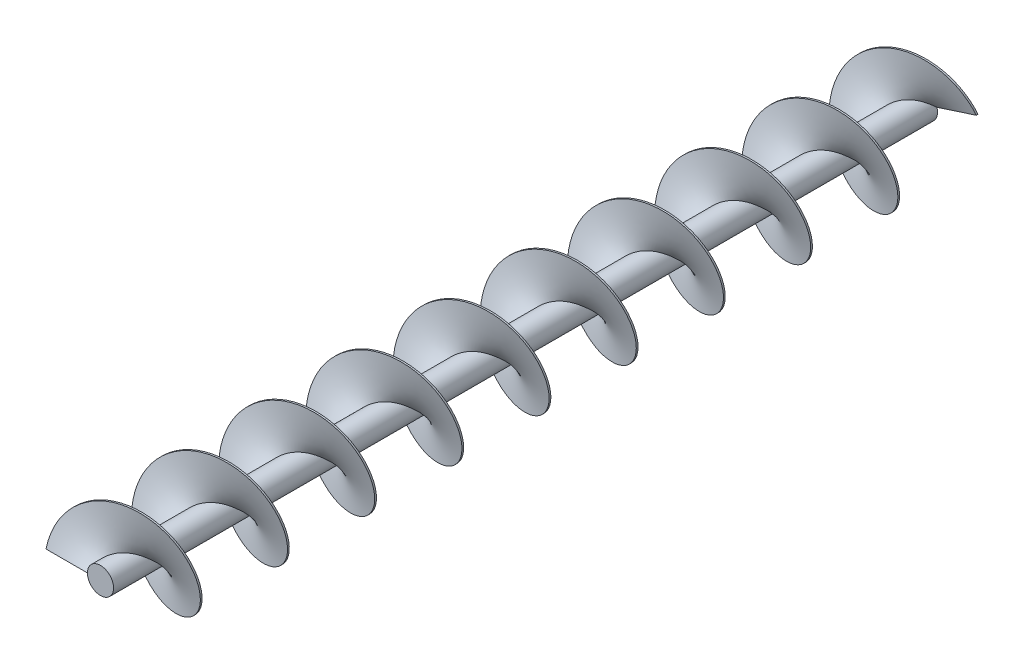
from build123d import *

# Parameters (mm, degrees)
SKETCH1_R           = 1.905
BOSS_EXTRUDE1_DEPTH = 60.0075
SWEEP1_PITCH        = 12.7
SKETCH6_R           = 1.27
SKETCH6_W           = 0.762
SKETCH6_H           = 1.524
CUT_EXTRUDE1_DEPTH  = 12.7


with BuildPart() as part:
    # Sketch1 → Boss-Extrude1 (new, symmetric)
    with BuildSketch(Plane.XY):
        with Locations(Location((0, 0, 0), (0, 0, 180))):
            Circle(SKETCH1_R)
    extrude(amount=BOSS_EXTRUDE1_DEPTH, both=True)

    # Sweep1: the profile of Sketch5 profile screwed along a right-hand helix of 9.45 turns, 18 arcs to a turn; built about Z, then put on its axis
    sweep1_z = Axis((0, 0, 0), (0, 0, 1))
    sweep1_corners = [(1.9047, 0, 0), (7.9375, 0, 0), (7.9375, 0, 0.254), (1.9047, 0, 0.254)]
    with BuildLine(mode=Mode.PRIVATE) as sweep1_profile:
        Line(sweep1_corners[0], sweep1_corners[1])
        Line(sweep1_corners[1], sweep1_corners[2])
        Line(sweep1_corners[2], sweep1_corners[3])
        Line(sweep1_corners[3], sweep1_corners[0])
    sweep1_cap = Face(sweep1_profile.wire())
    sweep1_turn_angles = [0, 10, 20, 30, 40, 50, 60, 70, 80, 90, 100, 110, 120, 130, 140, 150, 160, 170, 180, 190, 200, 210, 220, 230, 240, 250, 260, 270, 280, 290, 300, 310, 320, 330, 340, 350, 360]
    sweep1_turn_weights = [1, 0.984807753012208, 1, 0.984807753012208, 1, 0.984807753012208, 1, 0.984807753012208, 1, 0.984807753012208, 1, 0.984807753012208, 1, 0.984807753012208, 1, 0.984807753012208, 1, 0.984807753012208, 1, 0.984807753012208, 1, 0.984807753012208, 1, 0.984807753012208, 1, 0.984807753012208, 1, 0.984807753012208, 1, 0.984807753012208, 1, 0.984807753012208, 1, 0.984807753012208, 1, 0.984807753012208, 1]
    sweep1_turn_rails = [Edge.make_bspline([Vector(p[0], p[1], 0).rotate(sweep1_z, sweep1_turn_angles[k]) / sweep1_turn_weights[k] + Vector(0, 0, p[2] + SWEEP1_PITCH * sweep1_turn_angles[k] / 360) for k in range(37)], [0, 0, 0, 1, 1, 2, 2, 3, 3, 4, 4, 5, 5, 6, 6, 7, 7, 8, 8, 9, 9, 10, 10, 11, 11, 12, 12, 13, 13, 14, 14, 15, 15, 16, 16, 17, 17, 18, 18, 18], 2, sweep1_turn_weights) for p in sweep1_corners]
    sweep1_turn_sides = [Face.make_surface_from_curves(sweep1_turn_rails[p[0]], sweep1_turn_rails[p[1]]) for p in [(0, 1), (1, 2), (2, 3), (3, 0)]]
    sweep1_last_angles = [3240, 3250, 3260, 3270, 3280, 3290, 3300, 3310, 3320, 3330, 3340, 3350, 3360, 3370, 3380, 3390, 3400, 3401, 3402]
    sweep1_last_weights = [1, 0.984807753012208, 1, 0.984807753012208, 1, 0.984807753012208, 1, 0.984807753012208, 1, 0.984807753012208, 1, 0.984807753012208, 1, 0.984807753012208, 1, 0.984807753012208, 1, 0.9998476951563886, 1]
    sweep1_last_rails = [Edge.make_bspline([Vector(p[0], p[1], 0).rotate(sweep1_z, sweep1_last_angles[k]) / sweep1_last_weights[k] + Vector(0, 0, p[2] + SWEEP1_PITCH * sweep1_last_angles[k] / 360) for k in range(19)], [0, 0, 0, 1, 1, 2, 2, 3, 3, 4, 4, 5, 5, 6, 6, 7, 7, 8, 8, 9, 9, 9], 2, sweep1_last_weights) for p in sweep1_corners]
    sweep1_last_sides = [Face.make_surface_from_curves(sweep1_last_rails[p[0]], sweep1_last_rails[p[1]]) for p in [(0, 1), (1, 2), (2, 3), (3, 0)]]
    sweep1 = Plane(origin=(0, 0, 60.0075), x_dir=(-1, 0, 0), z_dir=(0, 0, -1)) * Solid(Shell([*[p.moved(Location((0, 0, SWEEP1_PITCH * i))) for i in range(9) for p in sweep1_turn_sides], *sweep1_last_sides, sweep1_cap, sweep1_cap.rotate(sweep1_z, 3402).moved(Location((0, 0, SWEEP1_PITCH * 3402 / 360)))]))
    add(sweep1)

    # Sketch6 → Cut-Extrude1 (cut)
    with BuildSketch(Plane(origin=(0, 0, -60.0075), x_dir=(-1, 0, 0), z_dir=(0, 0, -1))):
        Circle(SKETCH6_R)
        with Locations((0, 0.762)):
            Rectangle(SKETCH6_W, SKETCH6_H)
    extrude(amount=-CUT_EXTRUDE1_DEPTH, mode=Mode.SUBTRACT)


solid = part.part
